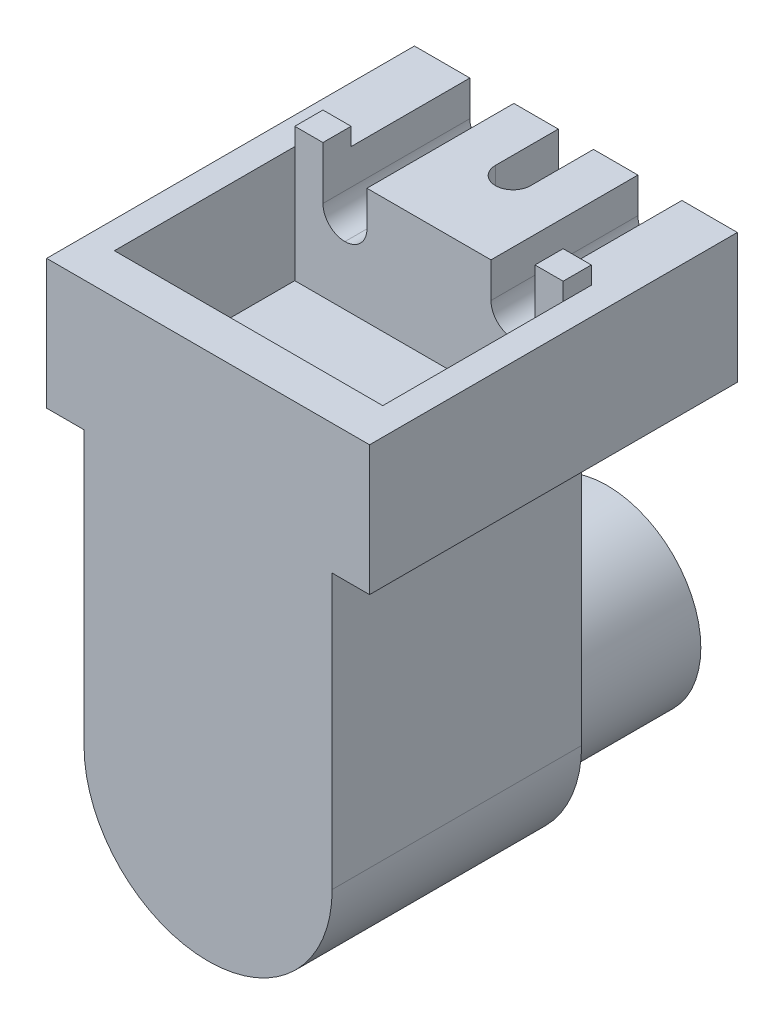
from build123d import *

# Parameters (mm, degrees)
RESSALTO_EXTRUS_O1_DEPTH = 28.35
ESBO_O3_W                = 36.7
ESBO_O3_H                = 41.8
RESSALTO_EXTRUS_O2_DEPTH = 14.75
ESBO_O5_W                = 30.5
ESBO_O5_H                = 20.5
CORTE_EXTRUS_O2_DEPTH    = 13.2
CORTE_EXTRUS_O3_DEPTH    = 69.850889609
ESBO_O7_W                = 5
ESBO_O7_H                = 16.7
CORTE_EXTRUS_O4_DEPTH    = 6.5
FILETE1_R                = 2.5
ESBO_O8_W                = 8.5
ESBO_O8_H                = 3.5
CORTE_EXTRUS_O5_DEPTH    = 14
ESBO_O9_W                = 3.2
ESBO_O9_H                = 3.2
RESSALTO_EXTRUS_O3_DEPTH = 2
ESBO_O10_R               = 10.65
RESSALTO_EXTRUS_O4_DEPTH = 17
ESBO_O11_R               = 4.25
CORTE_EXTRUS_O6_DEPTH    = 25


with BuildPart() as part:
    # Esboço1 → Ressalto-extrusão1 (new body)
    with BuildSketch(Plane.XY):
        with BuildLine():
            Line((14.1, -8.525), (14.1, 22.625))
            Line((14.1, 22.625), (-14.1, 22.625))
            Line((-14.1, 22.625), (-14.1, -8.525))
            ThreePointArc((-14.1, -8.525), (0, -22.625), (14.1, -8.525))
        make_face()
    extrude(amount=RESSALTO_EXTRUS_O1_DEPTH)

    # Esboço3 → Ressalto-extrusão2 (add)
    with BuildSketch(Plane(origin=(0, 22.625, 0), x_dir=(1, 0, 0), z_dir=(0, 1, 0))):
        with Locations((0, -7.45)):
            Rectangle(ESBO_O3_W, ESBO_O3_H)
    extrude(amount=RESSALTO_EXTRUS_O2_DEPTH)

    # Esboço5 → Corte-extrusão2 (cut)
    with BuildSketch(Plane(origin=(0, 37.375, 0), x_dir=(1, 0, 0), z_dir=(0, 1, 0))):
        with Locations((0, -13.5)):
            Rectangle(ESBO_O5_W, ESBO_O5_H)
    extrude(amount=-CORTE_EXTRUS_O2_DEPTH, mode=Mode.SUBTRACT)

    # Esboço6 → Corte-extrusão3 (cut, through all)
    with BuildSketch(Plane(origin=(0, 37.375, 0), x_dir=(1, 0, 0), z_dir=(0, 1, 0))):
        with BuildLine():
            Line((-2, 13.45), (-2, 6.30835312))
            ThreePointArc((-2, 6.30835312), (0, 4.30835312), (2, 6.30835312))
            Line((2, 6.30835312), (2, 13.45))
            Line((2, 13.45), (-2, 13.45))
        make_face()
    extrude(amount=-CORTE_EXTRUS_O3_DEPTH, mode=Mode.SUBTRACT)

    # Esboço7 → Corte-extrusão4 (cut)
    with BuildSketch(Plane(origin=(0, 37.375, 0), x_dir=(1, 0, 0), z_dir=(0, 1, 0))):
        with Locations((-9.55, 5.1)):
            Rectangle(ESBO_O7_W, ESBO_O7_H)
        with Locations((9.55, 5.1)):
            Rectangle(ESBO_O7_W, ESBO_O7_H)
    extrude(amount=-CORTE_EXTRUS_O4_DEPTH, mode=Mode.SUBTRACT)

    # Filete1
    filete1_edges = [part.edges().sort_by_distance(p)[0] for p in [
        (-12.05, 30.875, -5.1),
        (-7.05, 30.875, -5.1),
        (7.05, 30.875, -5.1),
        (12.05, 30.875, -5.1),
    ]]
    fillet(filete1_edges, radius=FILETE1_R - 0.0001)  # a hair under: the kernel refuses the full size

    # Esboço8 → Corte-extrusão5 (cut)
    with BuildSketch(Plane(origin=(0, 0, -13.45), x_dir=(-1, 0, 0), z_dir=(0, 0, -1))):
        with Locations((0.04245602, 30)):
            Rectangle(ESBO_O8_W, ESBO_O8_H)
    extrude(amount=-CORTE_EXTRUS_O5_DEPTH, mode=Mode.SUBTRACT)

    # Esboço9 → Ressalto-extrusão3 (add)
    with BuildSketch(Plane(origin=(0, 37.375, 0), x_dir=(1, 0, 0), z_dir=(0, 1, 0))):
        with Locations((-13.65, -1.65)):
            Rectangle(ESBO_O9_W, ESBO_O9_H)
        with Locations((13.65, -1.65)):
            Rectangle(ESBO_O9_W, ESBO_O9_H)
    extrude(amount=RESSALTO_EXTRUS_O3_DEPTH)

    # Esboço10 → Ressalto-extrusão4 (add)
    with BuildSketch(Plane(origin=(0, 0, 0), x_dir=(-1, 0, 0), z_dir=(0, 0, -1))):
        with Locations(Location((0, -9.125, 0), (0, 0, 180))):
            Circle(ESBO_O10_R)
    extrude(amount=RESSALTO_EXTRUS_O4_DEPTH)

    # Esboço11 → Corte-extrusão6 (cut)
    with BuildSketch(Plane(origin=(0, 0, -17), x_dir=(-1, 0, 0), z_dir=(0, 0, -1))):
        with Locations((0, -9.125)):
            Circle(ESBO_O11_R)
    extrude(amount=-CORTE_EXTRUS_O6_DEPTH, mode=Mode.SUBTRACT)


solid = part.part
